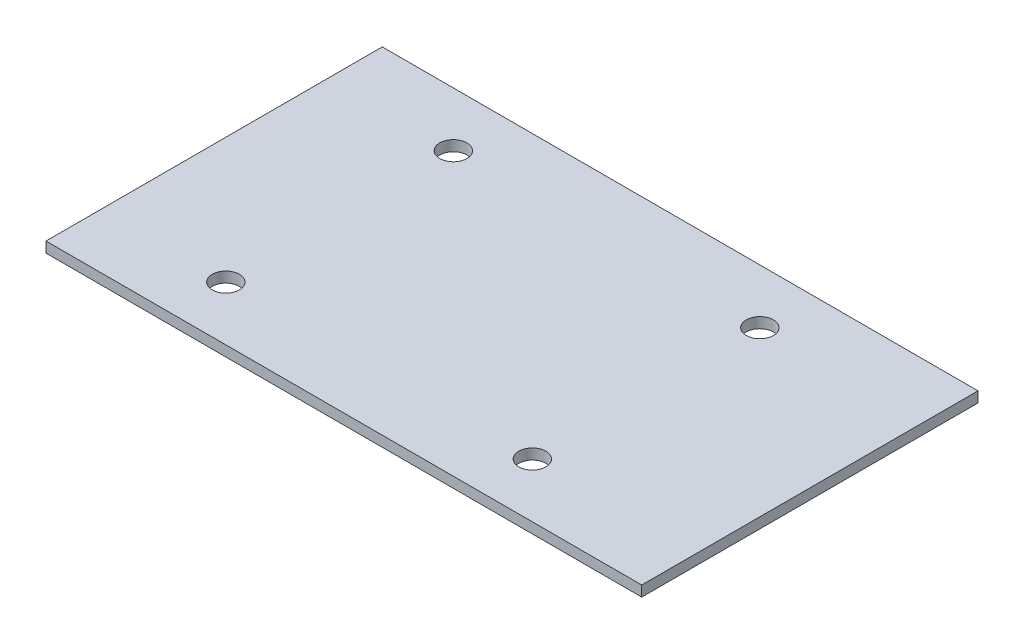
from build123d import *

# Parameters (mm, degrees)
SKETCH1_W           = 180
SKETCH1_H           = 101.6
SKETCH1_R           = 4.1
BOSS_EXTRUDE1_DEPTH = 3.175


with BuildPart() as part:
    # Sketch1 → Boss-Extrude1 (new body)
    with BuildSketch(Plane(origin=(0, 0, 0), x_dir=(1, 0, 0), z_dir=(0, 1, 0))):
        Rectangle(SKETCH1_W, SKETCH1_H)
        with Locations((-52.0875, 34.373488098)):
            Circle(SKETCH1_R, mode=Mode.SUBTRACT)
        with Locations((40.5125, 34.373488098)):
            Circle(SKETCH1_R, mode=Mode.SUBTRACT)
        with Locations((40.5125, -34.373488098)):
            Circle(SKETCH1_R, mode=Mode.SUBTRACT)
        with Locations((-52.0875, -34.373488098)):
            Circle(SKETCH1_R, mode=Mode.SUBTRACT)
    extrude(amount=BOSS_EXTRUDE1_DEPTH)


solid = part.part
